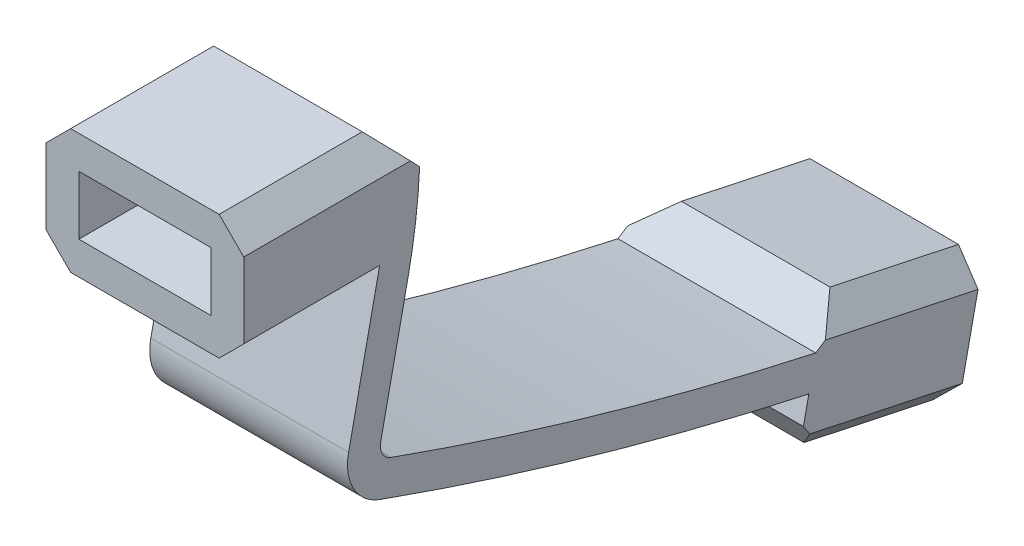
from build123d import *

# Parameters (mm, degrees)
SKETCH1_W           = 12.04
SKETCH1_H           = 7.58
SKETCH1_W_2         = 8.04
SKETCH1_H_2         = 3.58
BOSS_EXTRUDE1_DEPTH = 8
SKETCH1_2_W         = 12.04
SKETCH1_2_H         = 7.58
SKETCH1_2_W_2       = 8.04
SKETCH1_2_H_2       = 3.58
BOSS_EXTRUDE2_DEPTH = 2
EXTRUDE_THIN1_DEPTH = 12.04
SKETCH5_W           = 12.04
SKETCH5_H           = 7.58
SKETCH5_W_2         = 8.04
SKETCH5_H_2         = 3.58
BOSS_EXTRUDE4_DEPTH = 8
SKETCH5_4_W         = 12.04
SKETCH5_4_H         = 7.58
BOSS_EXTRUDE5_DEPTH = 2
CHAMFER1_SIZE       = 1.5
CHAMFER2_START      = -7
CHAMFER2_DEPTH      = 14


with BuildPart() as part:
    # Sketch1 → Boss-Extrude1 (new body)
    with BuildSketch(Plane.XY):
        Rectangle(SKETCH1_W, SKETCH1_H)
        Rectangle(SKETCH1_W_2, SKETCH1_H_2, mode=Mode.SUBTRACT)
    extrude(amount=BOSS_EXTRUDE1_DEPTH)

    # Sketch1<2> → Boss-Extrude2 (add)
    # profile 1 of 2: a face of its own
    with BuildSketch(Plane.XY):
        Rectangle(SKETCH1_2_W, SKETCH1_2_H)
        Rectangle(SKETCH1_2_W_2, SKETCH1_2_H_2, mode=Mode.SUBTRACT)
    # profile 2 of 2: a face of its own
    with BuildSketch(Plane.XY):
        Rectangle(SKETCH1_2_W_2, SKETCH1_2_H_2)
    extrude(amount=-BOSS_EXTRUDE2_DEPTH)

    # Sketch3 → Extrude-Thin1 (add)
    with BuildSketch(Plane(origin=(6.02, 9.81, 0), x_dir=(0, -1, 0), z_dir=(1, 0, 0))):
        with BuildLine():
            Line((6.02, 2.744137986), (6.52, 2.744137986))
            ThreePointArc((6.52, 2.744137986), (10.07949931, 2.557592532), (13.6, 2))
            Line((13.6, 2), (21.425180806, 0.336706473))
            ThreePointArc((21.425180806, 0.336706473), (22.120268588, 0.441550315), (22.574623539, 0.977927827))
            ThreePointArc((22.574623539, 0.977927827), (26.849152106, 14.317688881), (30.219561316, 27.914054616))
            Line((30.219561316, 27.914054616), (30.401286915, 28.769006338))
            Line((30.401286915, 28.769006338), (32.357582116, 28.353182957))
            Line((32.357582116, 28.353182957), (32.175856518, 27.498231234))
            ThreePointArc((32.175856518, 27.498231234), (28.773161162, 13.771621897), (24.457685624, 0.304075332))
            ThreePointArc((24.457685624, 0.304075332), (23.094620772, -1.305057203), (21.009357424, -1.619588728))
            Line((21.009357424, -1.619588728), (13.184176618, 0.043704799))
            ThreePointArc((13.184176618, 0.043704799), (9.870442383, 0.568548741), (6.52, 0.744137986))
            Line((6.52, 0.744137986), (6.02, 0.744137986))
            Line((6.02, 0.744137986), (6.02, 2.744137986))
        make_face()
    extrude(amount=-EXTRUDE_THIN1_DEPTH)



with BuildPart() as body_2:
    # Sketch5 → Boss-Extrude4 (new body)
    with BuildSketch(Plane(origin=(0, 484.189145571, -136.063399466), x_dir=(1, 0, 0), z_dir=(0, -0.20791169081775487, -0.9781476007338067))):
        with Locations((0, 517.847527624)):
            Rectangle(SKETCH5_W, SKETCH5_H)
        with Locations((0, 517.847527624)):
            Rectangle(SKETCH5_W_2, SKETCH5_H_2, mode=Mode.SUBTRACT)
    extrude(amount=BOSS_EXTRUDE4_DEPTH)


with BuildPart() as part_1:
    add(part.part)

    add(body_2.part)  # Boss-Extrude5 merges body 2
    # Sketch5<4> → Boss-Extrude5 (add)
    with BuildSketch(Plane(origin=(0, 484.189145571, -136.063399466), x_dir=(1, 0, 0), z_dir=(0, -0.20791169081775487, -0.9781476007338067))):
        with Locations((0, 517.847527624)):
            Rectangle(SKETCH5_4_W, SKETCH5_4_H)
    extrude(amount=-BOSS_EXTRUDE5_DEPTH)

    # Chamfer1
    chamfer1_edges = [part_1.edges().sort_by_distance(p)[0] for p in [
        (6.02, -26.673085599, -30.543301906),
        (-6.02, -26.673085599, -30.543301906),
        (6.02, 3.79, 2.627931007),
        (6.02, -3.79, 4.022340595),
        (-6.02, -3.79, 4.022340595),
        (-6.02, 3.79, 2.627931007),
        (6.02, -19.258726786, -32.119272522),
        (-6.02, -19.258726786, -32.119272522),
    ]]
    chamfer(chamfer1_edges, length=CHAMFER1_SIZE)

    # Chamfer2: read off the stored shape, not the designer's step
    # Chamfer2 outline → Chamfer2 (cut)
    with BuildSketch(Plane.YZ.offset(CHAMFER2_START)):
        with BuildLine():
            Line((3.79, -2.744137986), (3.79, -0.709020541))
            Line((3.79, -0.709020541), (1.696404781, -2.706829325))
            ThreePointArc((1.696404781, -2.706829325), (2.492984056, -2.734809543), (3.29, -2.744137986))
            Line((3.29, -2.744137986), (3.79, -2.744137986))
        make_face()
        Polygon((-25.633527145, -25.652563902), (-26.049350527, -27.608859104), (-23.677231944, -26.068387284), align=None)
        with BuildLine():
            ThreePointArc((-20.172493797, -26.813342374), (-20.172815684, -26.814817596), (-20.173137561, -26.81629282))
            Line((-20.173137561, -26.81629282), (-18.634991713, -29.18482972))
            Line((-18.634991713, -29.18482972), (-18.219168332, -27.228534519))
            Line((-18.219168332, -27.228534519), (-20.172493797, -26.813342374))
        make_face()
    extrude(amount=CHAMFER2_DEPTH, mode=Mode.SUBTRACT)


solid = part_1.part
